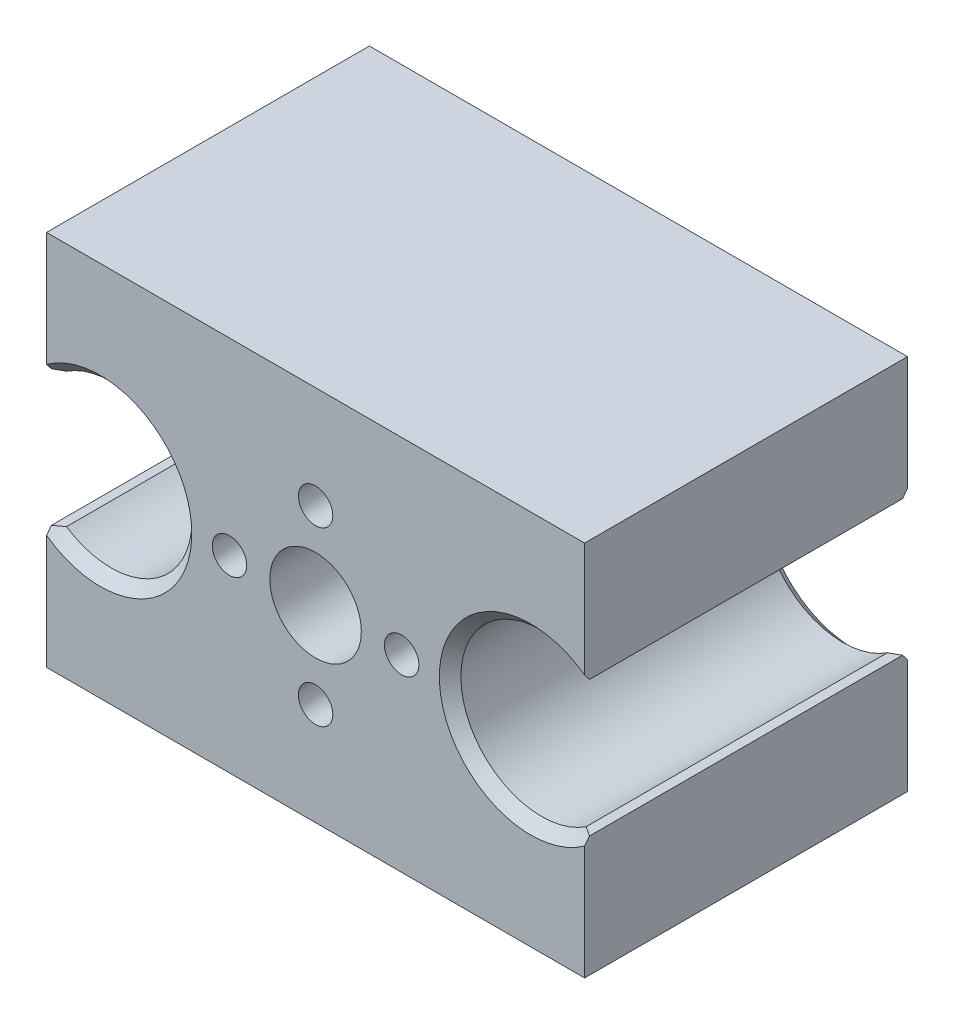
from build123d import *

# Parameters (mm, degrees)
SKETCH_1_W          = 50
SKETCH_1_H          = 35
EXTRUDE_1_DEPTH     = 30
HOLE_WIZARD_345_D   = 8.5
HOLE_WIZARD_450_D   = 3.2
HOLE_WIZARD_604_D   = 15
CHAMFER_1_SIZE      = 1
CHAMFER_1_SIZE_2    = 0.708203932
HOLE_WIZARD_1_D     = 10.5
HOLE_WIZARD_1_DEPTH = 12


with BuildPart() as part:
    # 草图1 → 凸台-拉伸1 (new body)
    with BuildSketch(Plane.XY):
        Rectangle(SKETCH_1_W, SKETCH_1_H)
    extrude(amount=EXTRUDE_1_DEPTH)

    # Hole Wizard 345 (through all)
    with Locations(Plane.XY.offset(30)):
        with Locations((0, 0)):
            Hole(HOLE_WIZARD_345_D / 2)

    # Hole Wizard 450 (through all)
    with Locations(Plane.XY.offset(30)):
        with Locations((8, 0), (0, 8), (-8, 0), (0, -8)):
            Hole(HOLE_WIZARD_450_D / 2)

    # Hole Wizard 604 (through all)
    with Locations(Plane.XY.offset(30)):
        with Locations((20, 0), (-20, 0)):
            Hole(HOLE_WIZARD_604_D / 2)

    # 倒角1
    # the kernel refuses this chamfer: 1, 0.708203932 mm, written as the material it takes off along each edge
    with BuildSketch(Plane(origin=(-20, 0, 0), x_dir=(-0.8790200859122482, 0.4767847402789059, 0), z_dir=(-0.4767847402789059, -0.8790200859122482, 0))) as chamfer_1_piece_1:
        Polygon((7.5, -CHAMFER_1_SIZE), (7.5 + CHAMFER_1_SIZE, 0), (7.5, 0), align=None)
    revolve(axis=Axis((-20, 0, 0), (0, 0, -1)), revolution_arc=303.048763938, mode=Mode.SUBTRACT)
    with BuildSketch(Plane(origin=(-20, 0, 30), x_dir=(-0.879020085912248, 0.47678474027890627, 0), z_dir=(-0.47678474027890627, -0.879020085912248, 0))) as chamfer_1_piece_2:
        Polygon((7.5 + CHAMFER_1_SIZE, 0), (7.5, CHAMFER_1_SIZE), (7.5, 0), align=None)
    revolve(axis=Axis((-20, 0, 30), (0, 0, -1)), revolution_arc=303.048763938, mode=Mode.SUBTRACT)
    with BuildSketch(Plane(origin=(20, 0, 30), x_dir=(0.879020085912248, -0.4767847402789061, 0), z_dir=(0.4767847402789061, 0.879020085912248, 0))) as chamfer_1_piece_3:
        Polygon((7.5 + CHAMFER_1_SIZE, 0), (7.5, CHAMFER_1_SIZE), (7.5, 0), align=None)
    revolve(axis=Axis((20, 0, 30), (0, 0, -1)), revolution_arc=303.048763938, mode=Mode.SUBTRACT)
    with BuildSketch(Plane(origin=(20, 0, 0), x_dir=(0.8790200859122481, 0.476784740278906, 0), z_dir=(0.476784740278906, -0.8790200859122481, 0))) as chamfer_1_piece_4:
        Polygon((7.5, CHAMFER_1_SIZE), (7.5 + CHAMFER_1_SIZE, 0), (7.5, 0), align=None)
    revolve(axis=Axis((20, 0, 0), (0, 0, 1)), revolution_arc=303.048763938, mode=Mode.SUBTRACT)
    with BuildSketch(Plane(origin=(-25, 5.590169944, 32.778051389), x_dir=(0.7914486393779661, 0.611235675682274, 0), z_dir=(0, 0, -1)), Plane(origin=(25, -5.590169944, 32.778051389), x_dir=(-0.7914486393779661, -0.611235675682274, 0), z_dir=(0, 0, -1))) as chamfer_1_piece_5:
        with BuildLine():
            Line((1.080663788, 0), (CHAMFER_1_SIZE_2 * 0.611235676113, -CHAMFER_1_SIZE_2 * 0.791448639936))
            Line((CHAMFER_1_SIZE_2 * 0.611235676113, -CHAMFER_1_SIZE_2 * 0.791448639936), (0, 0))
            ThreePointArc((0, 0), (0.555522087, -0.019473843), (1.080663788, 0))
        make_face()
    extrude(amount=35.556102778, mode=Mode.SUBTRACT)
    with BuildSketch(Plane(origin=(-25, -5.590169944, 32.778051389), x_dir=(0.7914486393779665, -0.6112356756822735, 0), z_dir=(0, 0, -1))) as chamfer_1_piece_6:
        with BuildLine():
            Line((1.080663788, 0), (CHAMFER_1_SIZE_2 * 0.611235676113, CHAMFER_1_SIZE_2 * 0.791448639936))
            Line((CHAMFER_1_SIZE_2 * 0.611235676113, CHAMFER_1_SIZE_2 * 0.791448639936), (0, 0))
            ThreePointArc((0, 0), (0.555522087, 0.019473843), (1.080663788, 0))
        make_face()
    extrude(amount=35.556102778, mode=Mode.SUBTRACT)
    with BuildSketch(Plane(origin=(25, 5.590169944, 32.778051389), x_dir=(0, 1, 0), z_dir=(0, 0, -1))) as chamfer_1_piece_7:
        with BuildLine():
            Line((CHAMFER_1_SIZE_2, 0), (0.660540261, -0.855289885))
            ThreePointArc((0.660540261, -0.855289885), (0.354967464, -0.427764092), (0, 0))
            Line((0, 0), (CHAMFER_1_SIZE_2, 0))
        make_face()
    extrude(amount=35.556102778, mode=Mode.SUBTRACT)

    # 孔1
    with Locations(Plane(origin=(0, 0, 0), x_dir=(-1, 0, 0), z_dir=(0, 0, -1))):
        with Locations((0, 0)):
            Hole(HOLE_WIZARD_1_D / 2, depth=HOLE_WIZARD_1_DEPTH)


solid = part.part
